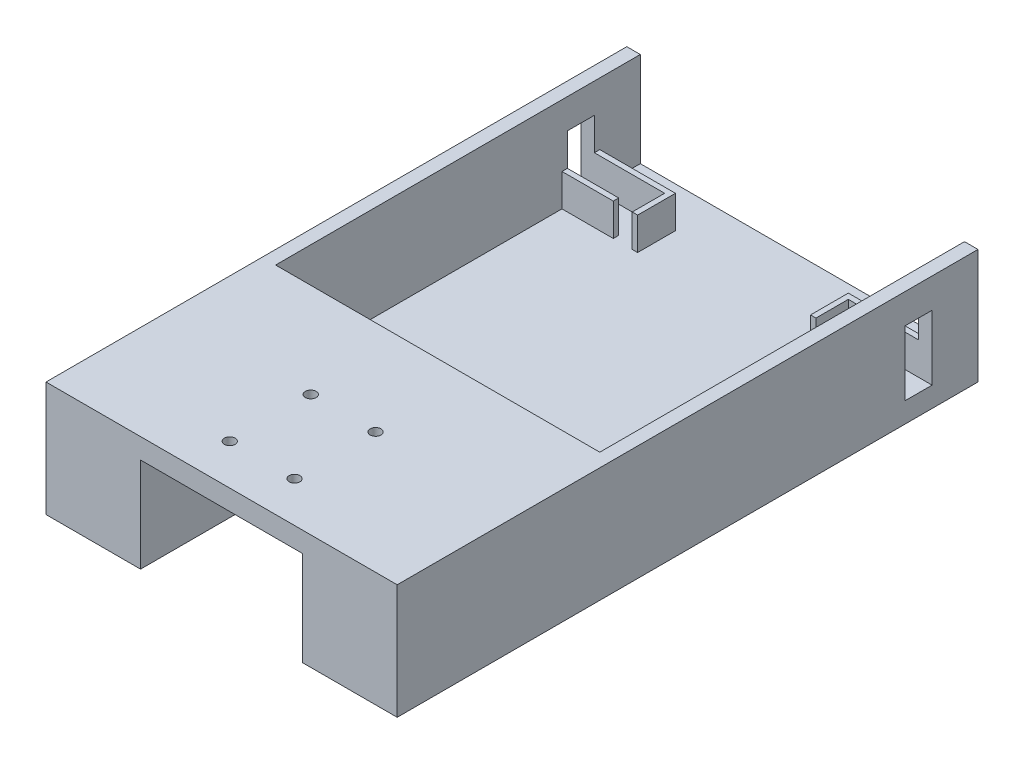
from build123d import *

# Parameters (mm, degrees)
SKETCH2_W                = 150
SKETCH2_H                = 40
BOSS_EXTRUDE1_DEPTH      = 225
SKETCH3_W                = 140
SKETCH3_H                = 35
CUT_EXTRUDE1_DEPTH       = 50
SKETCH4_W                = 26
SKETCH4_H                = 2
SKETCH4_W_2              = 20
BOSS_EXTRUDE2_DEPTH      = 15
SKETCH6_W                = 10
SKETCH6_H                = 15
CUT_EXTRUDE2_DEPTH       = 15
CUT_EXTRUDE3_DEPTH       = 67
SKETCH9_W                = 10
SKETCH9_H                = 15
CUT_EXTRUDE4_DEPTH       = 67
SKETCH12_W               = 14
SKETCH12_H               = 2
BOSS_EXTRUDE3_DEPTH      = 2.5
FILLET1_R                = 0.5
MIRROR3_START            = 196
MIRROR3_DEPTH            = 14
MIRROR3_START_2          = 15
MIRROR3_2_DEPTH          = 14
MIRROR3_3_DEPTH          = 2
MIRROR3_START_3          = 208
MIRROR3_4_DEPTH          = 2
MIRROR3_5_DEPTH          = 2
MIRROR3_START_4          = 27
MIRROR3_6_DEPTH          = 2
SKETCH16_W               = 32.5
SKETCH16_H               = 11.5
BOSS_EXTRUDE5_DEPTH      = 5
SKETCH17_R               = 1
BOSS_EXTRUDE7_DEPTH      = 25
SKETCH18_W               = 5
SKETCH18_H               = 50
SKETCH18_W_2             = 10
SKETCH18_H_2             = 5
BOSS_EXTRUDE8_DEPTH      = 7.5
SKETCH24_W               = 5.5
SKETCH24_H               = 28
BOSS_EXTRUDE11_DEPTH     = 50
SKETCH25_W               = 5
SKETCH25_H               = 28
BOSS_EXTRUDE12_DEPTH     = 190
SKETCH26_W               = 5
SKETCH26_H               = 28
BOSS_EXTRUDE13_DEPTH     = 190
SKETCH27_R               = 2.55
BOSS_EXTRUDE14_DEPTH     = 10
SKETCH29_W               = 10
SKETCH29_H               = 15
CUT_EXTRUDE5_DEPTH       = 19
SKETCH30_W               = 15
SKETCH30_H               = 20
BOSS_EXTRUDE15_DEPTH     = 7.5
SKETCH33_W               = 140
SKETCH33_H               = 35
BOSS_EXTRUDE16_DEPTH     = 50
BOSS_EXTRUDE18_DEPTH     = 5
CUT_EXTRUDE9_DEPTH       = 303.293317822
CUT_EXTRUDE9_DEPTH_BACK  = 303.293317822
SKETCH37_W               = 10
SKETCH37_H               = 45
SKETCH41_W               = 150
SKETCH41_H               = 50
CUT_EXTRUDE12_DEPTH      = 2.5
SKETCH42_W               = 2
SKETCH42_H               = 12
CUT_EXTRUDE13_DEPTH      = 15
SKETCH43_W               = 1
SKETCH43_H               = 2
CUT_EXTRUDE14_DEPTH      = 15
SKETCH44_W               = 10
SKETCH44_H               = 3
BOSS_EXTRUDE19_DEPTH     = 5
SKETCH45_W               = 10
SKETCH45_H               = 3
BOSS_EXTRUDE20_DEPTH     = 5
SKETCH46_W               = 65.791508331
SKETCH46_H               = 202.821994136
SKETCH46_W_2             = 83.130638558
CUT_EXTRUDE15_DEPTH      = 257.527288997
SKETCH50_W               = 14
SKETCH50_H               = 2
CUT_EXTRUDE18_DEPTH      = 2.5
SKETCH51_W               = 2
SKETCH51_H               = 14
BOSS_EXTRUDE21_DEPTH     = 15
SKETCH52_W               = 19
SKETCH52_H               = 2
CUT_EXTRUDE19_DEPTH      = 3
SKETCH53_W               = 10
SKETCH53_H               = 12
CUT_EXTRUDE20_DEPTH      = 5
SKETCH54_W               = 14
SKETCH54_H               = 2
CUT_EXTRUDE21_DEPTH      = 2.5
SKETCH55_W               = 1.5
SKETCH55_H               = 2
CUT_EXTRUDE22_DEPTH      = 15
SKETCH56_W               = 2
SKETCH56_H               = 14
BOSS_EXTRUDE22_DEPTH     = 15
SKETCH57_W               = 17.5
SKETCH57_H               = 2
CUT_EXTRUDE23_DEPTH      = 3
SKETCH58_W               = 1.5
SKETCH58_H               = 2
BOSS_EXTRUDE23_DEPTH     = 12
SKETCH59_W               = 10
SKETCH59_H               = 12
CUT_EXTRUDE24_DEPTH      = 5
SKETCH61_W               = 150
SKETCH61_H               = 32.5
CUT_EXTRUDE26_DEPTH      = 230.360524066
SKETCH63_W               = 150
SKETCH63_H               = 165
CUT_EXTRUDE27_DEPTH      = 10
SKETCH71_W               = 215
SKETCH71_H               = 42.5
CUT_EXTRUDE28_DEPTH      = 85
BOSS_EXTRUDE26_DEPTH     = 65
SKETCH73_W               = 10
SKETCH73_H               = 15
BOSS_EXTRUDE27_DEPTH     = 5
BOSS_EXTRUDE28_REACH     = 233.815
BOSS_EXTRUDE28_START     = -3
SKETCH74_W               = 5
SKETCH74_H               = 35
BOSS_EXTRUDE29_DEPTH     = 50
SKETCH75_W               = 10
SKETCH75_H               = 24
CUT_EXTRUDE29_DEPTH      = 14
CUT_EXTRUDE30_DEPTH      = 232.638187698
CUT_EXTRUDE30_DEPTH_BACK = 232.638187698
SKETCH76_R               = 2
CUT_EXTRUDE31_START      = -40
CUT_EXTRUDE31_OUTLINE_W  = 35
CUT_EXTRUDE31_OUTLINE_H  = 60
CUT_EXTRUDE31_DEPTH      = 60
SKETCH78_W               = 120
SKETCH78_H               = 35
CUT_EXTRUDE32_DEPTH      = 85


# Read off the part's stored shape, not the designer's step: Mirror3, Cut-Extrude31
with BuildPart() as part:
    # Sketch2 → Boss-Extrude1 (new body)
    with BuildSketch(Plane.XY):
        Rectangle(SKETCH2_W, SKETCH2_H)
    extrude(amount=BOSS_EXTRUDE1_DEPTH)

    # Sketch3 → Cut-Extrude1 (cut)
    with BuildSketch(Plane.XY.offset(225)):
        Rectangle(SKETCH3_W, SKETCH3_H)
    cut_extrude1 = extrude(amount=-CUT_EXTRUDE1_DEPTH, mode=Mode.SUBTRACT)

    # Sketch4 → Boss-Extrude2 (add)
    with BuildSketch(Plane(origin=(0, -17.5, 0), x_dir=(1, 0, 0), z_dir=(0, 1, 0))):
        Polygon((-42, -196), (-44, -196), (-44, -208), (-44, -210), (-42, -210), align=None)
        with Locations((-57, -209)):
            Rectangle(SKETCH4_W, SKETCH4_H)
        with Locations((-60, -197)):
            Rectangle(SKETCH4_W_2, SKETCH4_H)
        Polygon((70, -210), (70, -208), (44, -208), (44, -196), (42, -196), (42, -210), (44, -210), align=None)
        with Locations((60, -197)):
            Rectangle(SKETCH4_W_2, SKETCH4_H)
    boss_extrude2 = extrude(amount=BOSS_EXTRUDE2_DEPTH)

    # Sketch6 → Cut-Extrude2 (cut)
    with BuildSketch(Plane(origin=(-70, 0, 0), x_dir=(0, 0, -1), z_dir=(1, 0, 0))):
        with Locations((-203, -10)):
            Rectangle(SKETCH6_W, SKETCH6_H)
    cut_extrude2 = extrude(amount=-CUT_EXTRUDE2_DEPTH, mode=Mode.SUBTRACT)

    # Sketch8 → Cut-Extrude3 (cut)
    with BuildSketch(Plane(origin=(0, -17.5, 0), x_dir=(1, 0, 0), z_dir=(0, 1, 0))):
        with BuildLine():
            Line((-64.5, -179.5), (-49.5, -179.5))
            ThreePointArc((-49.5, -179.5), (-46, -183), (-49.5, -186.5))
            Line((-49.5, -186.5), (-64.5, -186.5))
            ThreePointArc((-64.5, -186.5), (-68, -183), (-64.5, -179.5))
        make_face()
        with BuildLine():
            Line((64.5, -179.5), (49.5, -179.5))
            ThreePointArc((49.5, -179.5), (46, -183), (49.5, -186.5))
            Line((49.5, -186.5), (64.5, -186.5))
            ThreePointArc((64.5, -186.5), (68, -183), (64.5, -179.5))
        make_face()
    cut_extrude3 = extrude(amount=CUT_EXTRUDE3_DEPTH, mode=Mode.SUBTRACT)

    # Sketch9 → Cut-Extrude4 (cut)
    with BuildSketch(Plane.ZY.offset(-70)):
        with Locations((203, -10)):
            Rectangle(SKETCH9_W, SKETCH9_H)
    cut_extrude4 = extrude(amount=-CUT_EXTRUDE4_DEPTH, mode=Mode.SUBTRACT)

    # Mirror1: Cut-Extrude1, Boss-Extrude2, Cut-Extrude2, Cut-Extrude3, Cut-Extrude4 across plane
    add(cut_extrude1.mirror(Plane.XY.offset(112.5)), mode=Mode.SUBTRACT)
    add(boss_extrude2.mirror(Plane.XY.offset(112.5)))
    add(cut_extrude2.mirror(Plane.XY.offset(112.5)), mode=Mode.SUBTRACT)
    add(cut_extrude3.mirror(Plane.XY.offset(112.5)), mode=Mode.SUBTRACT)
    add(cut_extrude4.mirror(Plane.XY.offset(112.5)), mode=Mode.SUBTRACT)

    # Sketch12 → Boss-Extrude3 (add)
    with BuildSketch(Plane.ZY.offset(-70)):
        with Locations((22, -1.5)):
            Rectangle(SKETCH12_W, SKETCH12_H)
    extrude(amount=BOSS_EXTRUDE3_DEPTH)

    # Fillet1
    fillet1_edges = [part.edges().sort_by_distance(p)[0] for p in [
        (67.5, -2.5, 22),
    ]]
    fillet(fillet1_edges, radius=FILLET1_R)

    # Mirror3 outline → Mirror3 (add)
    with BuildSketch(Plane.XY.offset(MIRROR3_START)):
        with BuildLine():
            Line((-70, -2.5), (-68, -2.5))
            ThreePointArc((-68, -2.5), (-67.646446609, -2.353553391), (-67.5, -2))
            Line((-67.5, -2), (-67.5, -0.5))
            Line((-67.5, -0.5), (-70, -0.5))
            Line((-70, -0.5), (-70, -2.5))
        make_face()
        with BuildLine():
            Line((68, -2.5), (70, -2.5))
            Line((70, -2.5), (70, -0.5))
            Line((70, -0.5), (67.5, -0.5))
            Line((67.5, -0.5), (67.5, -2))
            ThreePointArc((67.5, -2), (67.646446609, -2.353553391), (68, -2.5))
        make_face()
    extrude(amount=MIRROR3_DEPTH)

    # Mirror3 2 outline → Mirror3 2 (add)
    with BuildSketch(Plane.XY.offset(MIRROR3_START_2)):
        with BuildLine():
            Line((-70, -2.5), (-68, -2.5))
            ThreePointArc((-68, -2.5), (-67.646446609, -2.353553391), (-67.5, -2))
            Line((-67.5, -2), (-67.5, -0.5))
            Line((-67.5, -0.5), (-70, -0.5))
            Line((-70, -0.5), (-70, -2.5))
        make_face()
    extrude(amount=MIRROR3_2_DEPTH)

    # Mirror3 3 outline → Mirror3 3 (add)
    with BuildSketch(Plane.XY.offset(MIRROR3_START)):
        with BuildLine():
            ThreePointArc((-67.5, -2), (-67.646446609, -2.353553391), (-68, -2.5))
            Line((-68, -2.5), (-67.5, -2.5))
            Line((-67.5, -2.5), (-67.5, -2))
        make_face()
        with BuildLine():
            Line((67.5, -2.5), (68, -2.5))
            ThreePointArc((68, -2.5), (67.646446609, -2.353553391), (67.5, -2))
            Line((67.5, -2), (67.5, -2.5))
        make_face()
    extrude(amount=MIRROR3_3_DEPTH)

    # Mirror3 4 outline → Mirror3 4 (add)
    with BuildSketch(Plane.XY.offset(MIRROR3_START_3)):
        with BuildLine():
            ThreePointArc((-67.5, -2), (-67.646446609, -2.353553391), (-68, -2.5))
            Line((-68, -2.5), (-67.5, -2.5))
            Line((-67.5, -2.5), (-67.5, -2))
        make_face()
        with BuildLine():
            Line((67.5, -2.5), (68, -2.5))
            ThreePointArc((68, -2.5), (67.646446609, -2.353553391), (67.5, -2))
            Line((67.5, -2), (67.5, -2.5))
        make_face()
    extrude(amount=MIRROR3_4_DEPTH)

    # Mirror3 5 outline → Mirror3 5 (add)
    with BuildSketch(Plane.XY.offset(MIRROR3_START_2)):
        with BuildLine():
            ThreePointArc((-67.5, -2), (-67.646446609, -2.353553391), (-68, -2.5))
            Line((-68, -2.5), (-67.5, -2.5))
            Line((-67.5, -2.5), (-67.5, -2))
        make_face()
    extrude(amount=MIRROR3_5_DEPTH)

    # Mirror3 6 outline → Mirror3 6 (add)
    with BuildSketch(Plane.XY.offset(MIRROR3_START_4)):
        with BuildLine():
            ThreePointArc((-67.5, -2), (-67.646446609, -2.353553391), (-68, -2.5))
            Line((-68, -2.5), (-67.5, -2.5))
            Line((-67.5, -2.5), (-67.5, -2))
        make_face()
    extrude(amount=MIRROR3_6_DEPTH)

    # Sketch16 → Boss-Extrude5 (add)
    with BuildSketch(Plane(origin=(-70, 0, 0), x_dir=(0, 0, -1), z_dir=(1, 0, 0))):
        with Locations((16.25, -14.25)):
            Rectangle(SKETCH16_W, SKETCH16_H)
    boss_extrude5 = extrude(amount=-BOSS_EXTRUDE5_DEPTH)

    # Mirror4: Boss-Extrude5 across plane
    add(boss_extrude5.mirror(Plane(origin=(0, 0, 0), x_dir=(0, 0, 1), z_dir=(1, 0, 0))))

    # Sketch17 → Boss-Extrude7 (add)
    with BuildSketch(Plane.ZY.offset(-70)):
        with Locations(Location((-29.5, -14.25, 0), (0, 0, 270))):
            Circle(SKETCH17_R)
        with Locations(Location((-3, -14.25, 0), (0, 0, 270))):
            Circle(SKETCH17_R)
    boss_extrude7 = extrude(amount=BOSS_EXTRUDE7_DEPTH)

    # Mirror5: Boss-Extrude7 across plane
    add(boss_extrude7.mirror(Plane(origin=(0, 0, 0), x_dir=(0, 0, 1), z_dir=(1, 0, 0))))

    # Sketch18 → Boss-Extrude8 (add)
    with BuildSketch(Plane(origin=(0, 20, 0), x_dir=(1, 0, 0), z_dir=(0, 1, 0))):
        with Locations((-67.5, -80.5)):
            Rectangle(SKETCH18_W, SKETCH18_H)
        with Locations((67.5, -144.5)):
            Rectangle(SKETCH18_W, SKETCH18_H)
        with Locations((-30, -172)):
            Rectangle(SKETCH18_W_2, SKETCH18_H_2)
        with Locations((-30, -117)):
            Rectangle(SKETCH18_W_2, SKETCH18_H_2)
        with Locations((30, -108)):
            Rectangle(SKETCH18_W_2, SKETCH18_H_2)
        with Locations((30, -53)):
            Rectangle(SKETCH18_W_2, SKETCH18_H_2)
    extrude(amount=BOSS_EXTRUDE8_DEPTH)

    # Sketch24 → Boss-Extrude11 (add)
    with BuildSketch(Plane.ZY.offset(75)):
        with Locations((84.75, -6)):
            Rectangle(SKETCH24_W, SKETCH24_H)
    boss_extrude11 = extrude(amount=BOSS_EXTRUDE11_DEPTH)

    # Sketch25 → Boss-Extrude12 (add)
    with BuildSketch(Plane(origin=(0, 0, 82), x_dir=(-1, 0, 0), z_dir=(0, 0, -1))):
        with Locations((122.5, -6)):
            Rectangle(SKETCH25_W, SKETCH25_H)
    extrude(amount=BOSS_EXTRUDE12_DEPTH)

    # Mirror12: Boss-Extrude11 across plane
    add(boss_extrude11.mirror(Plane(origin=(0, 0, 0), x_dir=(0, 0, 1), z_dir=(1, 0, 0))))

    # Sketch26 → Boss-Extrude13 (add)
    with BuildSketch(Plane(origin=(0, 0, 82), x_dir=(-1, 0, 0), z_dir=(0, 0, -1))):
        with Locations((-122.5, -6)):
            Rectangle(SKETCH26_W, SKETCH26_H)
    extrude(amount=BOSS_EXTRUDE13_DEPTH)

    # Sketch27 → Boss-Extrude14 (add)
    with BuildSketch(Plane.ZY.offset(-120)):
        with Locations(Location((-100.5, -6, 0), (0, 0, 180))):
            Circle(SKETCH27_R)
    extrude(amount=BOSS_EXTRUDE14_DEPTH)

    # Sketch29 → Cut-Extrude5 (cut)
    with BuildSketch(Plane.ZY.offset(125)):
        with Locations((-100.5, -6)):
            Rectangle(SKETCH29_W, SKETCH29_H)
    extrude(amount=-CUT_EXTRUDE5_DEPTH, mode=Mode.SUBTRACT)

    # Sketch30 → Boss-Extrude15 (add)
    with BuildSketch(Plane.ZY.offset(125)):
        with Locations((-100.5, -6)):
            Rectangle(SKETCH30_W, SKETCH30_H)
    extrude(amount=BOSS_EXTRUDE15_DEPTH)

    # Sketch33 → Boss-Extrude16 (add)
    with BuildSketch(Plane.XY.offset(175)):
        Rectangle(SKETCH33_W, SKETCH33_H)
    extrude(amount=BOSS_EXTRUDE16_DEPTH)

    # Sketch36 → Boss-Extrude18 (add)
    with BuildSketch(Plane.XZ.offset(20)):
        Polygon((-75, 225), (-75, 87.5), (-125, 87.5), (-125, -108), (-120, -108), (-120, 82), (-75, 82), (-75, -32.5), (-70, -32.5), (-70, 0), (70, 0), (70, -32.5), (75, -32.5), (75, 82), (120, 82), (120, -108), (125, -108), (125, 87.5), (75, 87.5), (75, 225), align=None)
    extrude(amount=BOSS_EXTRUDE18_DEPTH)

    # Sketch37 → Cut-Extrude9 (cut, two sides: drawn at the far end of the back side and taken through both)
    with BuildSketch(Plane.ZY.offset(75).offset(-CUT_EXTRUDE9_DEPTH_BACK)):
        with Locations((220, -2.5)):
            Rectangle(SKETCH37_W, SKETCH37_H)
    extrude(amount=CUT_EXTRUDE9_DEPTH + CUT_EXTRUDE9_DEPTH_BACK, mode=Mode.SUBTRACT)

    # Sketch41 → Cut-Extrude12 (cut)
    with BuildSketch(Plane(origin=(0, 20, 0), x_dir=(1, 0, 0), z_dir=(0, 1, 0))):
        with Locations((0, -25)):
            Rectangle(SKETCH41_W, SKETCH41_H)
    extrude(amount=-CUT_EXTRUDE12_DEPTH, mode=Mode.SUBTRACT)

    # Sketch42 → Cut-Extrude13 (cut)
    with BuildSketch(Plane(origin=(0, -2.5, 0), x_dir=(1, 0, 0), z_dir=(0, 1, 0))):
        with Locations((-43, -23)):
            Rectangle(SKETCH42_W, SKETCH42_H)
        with Locations((43, -23)):
            Rectangle(SKETCH42_W, SKETCH42_H)
    extrude(amount=-CUT_EXTRUDE13_DEPTH, mode=Mode.SUBTRACT)

    # Sketch43 → Cut-Extrude14 (cut)
    with BuildSketch(Plane(origin=(0, -2.5, 0), x_dir=(1, 0, 0), z_dir=(0, 1, 0))):
        with Locations((-50.5, -28)):
            Rectangle(SKETCH43_W, SKETCH43_H)
        with Locations((50.5, -28)):
            Rectangle(SKETCH43_W, SKETCH43_H)
    extrude(amount=-CUT_EXTRUDE14_DEPTH, mode=Mode.SUBTRACT)

    # Sketch44 → Boss-Extrude19 (add)
    with BuildSketch(Plane.ZY.offset(75)):
        with Locations((22, -4)):
            Rectangle(SKETCH44_W, SKETCH44_H)
    extrude(amount=-BOSS_EXTRUDE19_DEPTH)

    # Sketch45 → Boss-Extrude20 (add)
    with BuildSketch(Plane(origin=(75, 0, 0), x_dir=(0, 0, -1), z_dir=(1, 0, 0))):
        with Locations((-22, -4)):
            Rectangle(SKETCH45_W, SKETCH45_H)
    extrude(amount=-BOSS_EXTRUDE20_DEPTH)

    # Sketch46 → Cut-Extrude15 (cut, through all)
    with BuildSketch(Plane(origin=(0, 20, 0), x_dir=(1, 0, 0), z_dir=(0, 1, 0))):
        with Locations((107.895754166, 13.910997068)):
            Rectangle(SKETCH46_W, SKETCH46_H)
        with Locations((-116.565319279, 13.910997068)):
            Rectangle(SKETCH46_W_2, SKETCH46_H)
    extrude(amount=-CUT_EXTRUDE15_DEPTH, mode=Mode.SUBTRACT)

    # Sketch50 → Cut-Extrude18 (cut)
    with BuildSketch(Plane(origin=(-67.5, 0, 0), x_dir=(0, 0, -1), z_dir=(1, 0, 0))):
        with Locations((-22, -1.5)):
            Rectangle(SKETCH50_W, SKETCH50_H)
    extrude(amount=-CUT_EXTRUDE18_DEPTH, mode=Mode.SUBTRACT)

    # Sketch51 → Boss-Extrude21 (add)
    with BuildSketch(Plane(origin=(0, -2.5, 0), x_dir=(1, 0, 0), z_dir=(0, 1, 0))):
        with Locations((-43, -22)):
            Rectangle(SKETCH51_W, SKETCH51_H)
    extrude(amount=-BOSS_EXTRUDE21_DEPTH)

    # Sketch52 → Cut-Extrude19 (cut)
    with BuildSketch(Plane(origin=(0, -2.5, 0), x_dir=(1, 0, 0), z_dir=(0, 1, 0))):
        with Locations((-60.5, -28)):
            Rectangle(SKETCH52_W, SKETCH52_H)
        Polygon((-70, -15), (-44, -15), (-42, -15), (-42, -29), (-44, -29), (-44, -17), (-70, -17), align=None)
    extrude(amount=-CUT_EXTRUDE19_DEPTH, mode=Mode.SUBTRACT)

    # Sketch53 → Cut-Extrude20 (cut)
    with BuildSketch(Plane.ZY.offset(75)):
        with Locations((22, 0.5)):
            Rectangle(SKETCH53_W, SKETCH53_H)
    extrude(amount=-CUT_EXTRUDE20_DEPTH, mode=Mode.SUBTRACT)

    # Sketch54 → Cut-Extrude21 (cut)
    with BuildSketch(Plane.ZY.offset(-67.5)):
        with Locations((22, -1.5)):
            Rectangle(SKETCH54_W, SKETCH54_H)
    extrude(amount=-CUT_EXTRUDE21_DEPTH, mode=Mode.SUBTRACT)

    # Sketch55 → Cut-Extrude22 (cut)
    with BuildSketch(Plane(origin=(0, -2.5, 0), x_dir=(1, 0, 0), z_dir=(0, 1, 0))):
        with Locations((51.75, -28)):
            Rectangle(SKETCH55_W, SKETCH55_H)
    extrude(amount=-CUT_EXTRUDE22_DEPTH, mode=Mode.SUBTRACT)

    # Sketch56 → Boss-Extrude22 (add)
    with BuildSketch(Plane(origin=(0, -2.5, 0), x_dir=(1, 0, 0), z_dir=(0, 1, 0))):
        with Locations((43, -22)):
            Rectangle(SKETCH56_W, SKETCH56_H)
    extrude(amount=-BOSS_EXTRUDE22_DEPTH)

    # Sketch57 → Cut-Extrude23 (cut)
    with BuildSketch(Plane(origin=(0, -2.5, 0), x_dir=(1, 0, 0), z_dir=(0, 1, 0))):
        Polygon((70, -15), (44, -15), (42, -15), (42, -29), (44, -29), (44, -17), (70, -17), align=None)
        with Locations((61.25, -28)):
            Rectangle(SKETCH57_W, SKETCH57_H)
    extrude(amount=-CUT_EXTRUDE23_DEPTH, mode=Mode.SUBTRACT)

    # Sketch58 → Boss-Extrude23 (add)
    with BuildSketch(Plane(origin=(0, -5.5, 0), x_dir=(1, 0, 0), z_dir=(0, 1, 0))):
        with Locations((51.75, -28)):
            Rectangle(SKETCH58_W, SKETCH58_H)
    extrude(amount=-BOSS_EXTRUDE23_DEPTH)

    # Sketch59 → Cut-Extrude24 (cut)
    with BuildSketch(Plane(origin=(75, 0, 0), x_dir=(0, 0, -1), z_dir=(1, 0, 0))):
        with Locations((-22, 0.5)):
            Rectangle(SKETCH59_W, SKETCH59_H)
    extrude(amount=-CUT_EXTRUDE24_DEPTH, mode=Mode.SUBTRACT)

    # Sketch61 → Cut-Extrude26 (cut, through all)
    with BuildSketch(Plane(origin=(0, 0, 0), x_dir=(1, 0, 0), z_dir=(0, 1, 0))):
        with Locations((0, 16.25)):
            Rectangle(SKETCH61_W, SKETCH61_H)
    extrude(amount=-CUT_EXTRUDE26_DEPTH, mode=Mode.SUBTRACT)

    # Sketch63 → Cut-Extrude27 (cut)
    with BuildSketch(Plane(origin=(0, 27.5, 0), x_dir=(1, 0, 0), z_dir=(0, 1, 0))):
        with Locations((0, -132.5)):
            Rectangle(SKETCH63_W, SKETCH63_H)
    extrude(amount=-CUT_EXTRUDE27_DEPTH, mode=Mode.SUBTRACT)

    # Sketch71 → Cut-Extrude28 (cut)
    with BuildSketch(Plane(origin=(75, 0, 0), x_dir=(0, 0, -1), z_dir=(1, 0, 0))):
        with Locations((-107.5, -3.75)):
            Rectangle(SKETCH71_W, SKETCH71_H)
    extrude(amount=-CUT_EXTRUDE28_DEPTH, mode=Mode.SUBTRACT)

    # Sketch72 → Boss-Extrude26 (add)
    with BuildSketch(Plane(origin=(-10, 0, 0), x_dir=(0, 0, -1), z_dir=(1, 0, 0))):
        Polygon((0, -17.5), (-50, -17.5), (-50, 17.5), (-215, 17.5), (-215, -25), (0, -25), align=None)
    extrude(amount=BOSS_EXTRUDE26_DEPTH)

    # Sketch73 → Boss-Extrude27 (add)
    with BuildSketch(Plane.ZY.offset(70)):
        with Locations((203, -10)):
            Rectangle(SKETCH73_W, SKETCH73_H)
    extrude(amount=BOSS_EXTRUDE27_DEPTH)

    # Sketch23 → Boss-Extrude28 (add, up to next)
    with BuildSketch(Plane(origin=(0, -2.5, 0), x_dir=(1, 0, 0), z_dir=(0, 1, 0)).offset(BOSS_EXTRUDE28_START), mode=Mode.PRIVATE) as boss_extrude28_sk1:
        Polygon((31, -27), (31, -29), (47.5, -29), (50, -29), (50, -27), (47.5, -27), align=None)
    boss_extrude28_tool1 = extrude(boss_extrude28_sk1.sketch, amount=-BOSS_EXTRUDE28_REACH, mode=Mode.PRIVATE) - part.part
    # Sketch23 → Boss-Extrude28 (add, up to next)
    with BuildSketch(Plane(origin=(0, -2.5, 0), x_dir=(1, 0, 0), z_dir=(0, 1, 0)).offset(BOSS_EXTRUDE28_START), mode=Mode.PRIVATE) as boss_extrude28_sk2:
        Polygon((50, -17), (47.5, -17), (24, -17), (24, -29), (22, -29), (22, -15), (47.5, -15), (50, -15), align=None)
    boss_extrude28_tool2 = extrude(boss_extrude28_sk2.sketch, amount=-BOSS_EXTRUDE28_REACH, mode=Mode.PRIVATE) - part.part
    add(boss_extrude28_tool1.solids().sort_by_distance((40.5, -5.5, 28))[0])
    add(boss_extrude28_tool2.solids().sort_by_distance((48.75, -5.5, 16.68695))[0])

    # Sketch74 → Boss-Extrude29 (add)
    with BuildSketch(Plane(origin=(0, 0, 50), x_dir=(-1, 0, 0), z_dir=(0, 0, -1))):
        with Locations((-52.5, 0)):
            Rectangle(SKETCH74_W, SKETCH74_H)
    extrude(amount=BOSS_EXTRUDE29_DEPTH)

    # Sketch75 → Cut-Extrude29 (cut)
    with BuildSketch(Plane.ZY.offset(-50)):
        with Locations((22, -5.5)):
            Rectangle(SKETCH75_W, SKETCH75_H)
    extrude(amount=-CUT_EXTRUDE29_DEPTH, mode=Mode.SUBTRACT)

    # Sketch76 → Cut-Extrude30 (cut, two sides: drawn at the far end of the back side and taken through both)
    with BuildSketch(Plane.XZ.offset(25).offset(-CUT_EXTRUDE30_DEPTH_BACK)):
        with Locations(Location((2, 170, 0), (0, 0, 270))):
            Circle(SKETCH76_R)
        with Locations(Location((-22, 170, 0), (0, 0, 270))):
            Circle(SKETCH76_R)
        with Locations(Location((-22, 200, 0), (0, 0, 270))):
            Circle(SKETCH76_R)
        with Locations(Location((2, 200, 0), (0, 0, 270))):
            Circle(SKETCH76_R)
    extrude(amount=CUT_EXTRUDE30_DEPTH + CUT_EXTRUDE30_DEPTH_BACK, mode=Mode.SUBTRACT)

    # Cut-Extrude31 outline → Cut-Extrude31 (cut)
    with BuildSketch(Plane.YZ.offset(CUT_EXTRUDE31_START)):
        with Locations((-7.5, 185)):
            Rectangle(CUT_EXTRUDE31_OUTLINE_W, CUT_EXTRUDE31_OUTLINE_H)
    extrude(amount=CUT_EXTRUDE31_DEPTH, mode=Mode.SUBTRACT)

    # Sketch78 → Cut-Extrude32 (cut)
    with BuildSketch(Plane(origin=(0, 0, 50), x_dir=(-1, 0, 0), z_dir=(0, 0, -1))):
        with Locations((10, 0)):
            Rectangle(SKETCH78_W, SKETCH78_H)
    extrude(amount=-CUT_EXTRUDE32_DEPTH, mode=Mode.SUBTRACT)


solid = part.part
